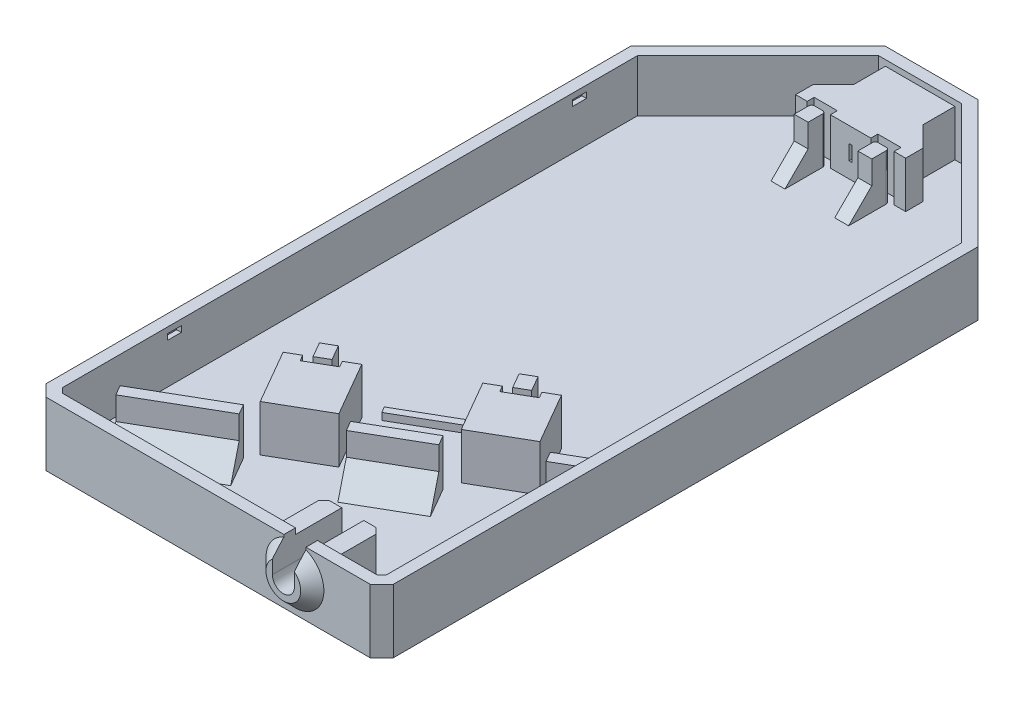
from build123d import *

# Parameters (mm, degrees)
BOSS_EXTRUDE1_DEPTH     = 11
SHELL1_T                = -2
CUT_EXTRUDE7_START      = -0.8
SKETCH18_W              = 2.4
SKETCH18_H              = 1
CUT_EXTRUDE7_DEPTH      = 57.6
SKETCH17_W              = 2.4
SKETCH17_H              = 1
CUT_EXTRUDE8_DEPTH      = 0.8
BOSS_EXTRUDE2_DEPTH     = 8
CUT_EXTRUDE1_DEPTH      = 7.5
CUT_EXTRUDE2_REACH      = 123.767
SKETCH6_R               = 1.3
BOSS_EXTRUDE6_DEPTH     = 8
SKETCH7_R               = 5
BOSS_EXTRUDE4_DEPTH     = 2
CHAMFER2_SIZE           = 2
BOSS_EXTRUDE8_DEPTH     = 8
CUT_EXTRUDE3_REACH      = 132.958
SKETCH9_R               = 1.9
SKETCH10_W              = 3.8
SKETCH10_H              = 12
CUT_EXTRUDE4_DEPTH      = 5
CUT_EXTRUDE5_DEPTH      = 6.75
CUT_EXTRUDE5_DEPTH_BACK = 0.4
SKETCH11_W              = 4.2
SKETCH11_H              = 4
SKETCH13_W              = 3.25
SKETCH13_H              = 8
BOSS_EXTRUDE5_DEPTH     = 1
CHAMFER3_SIZE           = 4
SKETCH16_R              = 0.95
BOSS_EXTRUDE7_DEPTH     = 0.5
CHAMFER4_SIZE           = 0.5
SKETCH21_W              = 0.4
SKETCH21_H              = 3.5
BOSS_EXTRUDE9_DEPTH     = 0.2
CHAMFER5_SIZE           = 0.2
BOSS_EXTRUDE10_DEPTH    = 1.2


with BuildPart() as part:
    # Sketch1 → Boss-Extrude1 (new body)
    with BuildSketch(Plane(origin=(0, 0, 0), x_dir=(1, 0, 0), z_dir=(0, 1, 0))):
        Polygon((-30, 66), (-30, -35), (-28, -37), (28, -37), (30, -35), (30, 66), (8, 88), (-8, 88), align=None)
    extrude(amount=BOSS_EXTRUDE1_DEPTH)

    # Shell1
    shell1_openings = [part.faces().sort_by_distance(p)[0] for p in [
        (0, 11, -21.727419662),
    ]]
    offset(amount=SHELL1_T, openings=shell1_openings, kind=Kind.INTERSECTION)

    # Sketch18 → Cut-Extrude7 (cut)
    with BuildSketch(Plane(origin=(-28, 0, 0), x_dir=(0, 0, -1), z_dir=(1, 0, 0)).offset(CUT_EXTRUDE7_START)):
        with Locations((-14.828427125, 9.5)):
            Rectangle(SKETCH18_W, SKETCH18_H)
        with Locations((55.171572875, 9.5)):
            Rectangle(SKETCH18_W, SKETCH18_H)
    extrude(amount=CUT_EXTRUDE7_DEPTH, mode=Mode.SUBTRACT)

    # Sketch17 → Cut-Extrude8 (cut)
    with BuildSketch(Plane.XY.offset(35)):
        with Locations((0, 9.5)):
            Rectangle(SKETCH17_W, SKETCH17_H)
    extrude(amount=CUT_EXTRUDE8_DEPTH, mode=Mode.SUBTRACT)

    # Sketch4 → Boss-Extrude2 (add)
    with BuildSketch(Plane(origin=(0, 2, 0), x_dir=(1, 0, 0), z_dir=(0, 1, 0))):
        Polygon((-6, 80.5), (-9.5, 77), (-9.5, 74), (-7.5, 74), (-7.5, 75.2), (-3.5, 75.2), (-3.5, 74), (3.5, 74), (3.5, 75.2), (7.5, 75.2), (7.5, 74), (9.5, 74), (9.5, 77), (6, 80.5), (6, 86), (-6, 86), align=None)
        with BuildLine():
            Line((-6.2, 73.95), (-4.8, 73.95))
            ThreePointArc((-4.8, 73.95), (-4.446446609, 73.803553391), (-4.3, 73.45))
            Line((-4.3, 73.45), (-4.3, 70.95))
            Line((-4.3, 70.95), (-6.7, 70.95))
            Line((-6.7, 70.95), (-6.7, 73.45))
            ThreePointArc((-6.7, 73.45), (-6.553553391, 73.803553391), (-6.2, 73.95))
        make_face()
        with BuildLine():
            Line((6.2, 73.95), (4.8, 73.95))
            ThreePointArc((4.8, 73.95), (4.446446609, 73.803553391), (4.3, 73.45))
            Line((4.3, 73.45), (4.3, 70.95))
            Line((4.3, 70.95), (6.7, 70.95))
            Line((6.7, 70.95), (6.7, 73.45))
            ThreePointArc((6.7, 73.45), (6.553553391, 73.803553391), (6.2, 73.95))
        make_face()
    extrude(amount=BOSS_EXTRUDE2_DEPTH)

    # Sketch5 → Cut-Extrude1 (cut)
    with BuildSketch(Plane(origin=(0, 0, -88), x_dir=(-1, 0, 0), z_dir=(0, 0, -1))):
        with BuildLine():
            Line((-2.175, 9.175), (2.175, 9.175))
            Line((2.175, 9.175), (3.175, 9.175))
            Line((3.175, 9.175), (3.175, 8.175))
            Line((3.175, 8.175), (3.175, 6.8))
            ThreePointArc((3.175, 6.8), (3.975, 6), (3.175, 5.2))
            Line((3.175, 5.2), (3.175, 2.825))
            Line((3.175, 2.825), (-3.175, 2.825))
            Line((-3.175, 2.825), (-3.175, 5.2))
            ThreePointArc((-3.175, 5.2), (-3.975, 6), (-3.175, 6.8))
            Line((-3.175, 6.8), (-3.175, 8.175))
            Line((-3.175, 8.175), (-3.175, 9.175))
            Line((-3.175, 9.175), (-2.175, 9.175))
        make_face()
    extrude(amount=-CUT_EXTRUDE1_DEPTH, mode=Mode.SUBTRACT)

    # Sketch6 → Cut-Extrude2 (cut, up to next)
    with BuildSketch(Plane(origin=(0, 0, -80.5), x_dir=(-1, 0, 0), z_dir=(0, 0, -1)), mode=Mode.PRIVATE) as cut_extrude2_sk1:
        with Locations((0, 6)):
            Circle(SKETCH6_R)
    cut_extrude2_tool1 = extrude(cut_extrude2_sk1.sketch, amount=-CUT_EXTRUDE2_REACH, mode=Mode.PRIVATE) & part.part
    add(cut_extrude2_tool1.solids().sort_by_distance((0, 6, -80.5))[0], mode=Mode.SUBTRACT)

    # Sketch15 → Boss-Extrude6 (add)
    with BuildSketch(Plane(origin=(0, 2, 0), x_dir=(1, 0, 0), z_dir=(0, 1, 0))):
        Polygon((-15.242047107, -8.8), (-9.842047107, -18.153074361), (-1.225094339, -13.178074361), (-6.625094339, -3.825), (-8.768507213, -5.0625), (-8.168507213, -6.101730485), (-12.498634232, -8.601730485), (-13.098634232, -7.5625), align=None)
        Polygon((-9.800892833, -21.824355653), (-10.800892833, -20.092304845), (-24.310889132, -27.892304845), (-23.310889132, -29.624355653), align=None)
        Polygon((11.066248612, -7.467304845), (0.933751388, -13.317304845), (1.933751388, -15.049355653), (12.066248612, -9.199355653), align=None)
        Polygon((28, 0), (28, 2.309401077), (22.800892833, -0.692304845), (23.800892833, -2.424355653), align=None)
        Polygon((-11.997801207, -6.86919873), (-9.919340238, -5.66919873), (-11.419340238, -3.071122518), (-13.497801207, -4.271122518), align=None)
        Polygon((8.369340238, 8.353877482), (9.869340238, 5.75580127), (11.947801207, 6.95580127), (10.447801207, 9.553877482), align=None)
        Polygon((15.242047107, 8.8), (13.098634232, 7.5625), (13.698634232, 6.523269515), (9.368507213, 4.023269515), (8.768507213, 5.0625), (6.625094339, 3.825), (11.700094339, -4.965157848), (20.317047107, 0.009842152), align=None)
    extrude(amount=BOSS_EXTRUDE6_DEPTH)

    # Sketch7 → Boss-Extrude4 (add)
    with BuildSketch(Plane.XY.offset(37)):
        with Locations(Location((15, 6, 0), (0, 0, 90))):
            Circle(SKETCH7_R)
    extrude(amount=BOSS_EXTRUDE4_DEPTH)

    # Chamfer2
    chamfer2_edges = [part.edges().sort_by_distance(p)[0] for p in [
        (15, 1, 39),
    ]]
    chamfer(chamfer2_edges, length=CHAMFER2_SIZE - 0.0001)  # a hair under: the kernel refuses the full size

    # Sketch19 → Boss-Extrude8 (add)
    with BuildSketch(Plane(origin=(0, 2, 0), x_dir=(1, 0, 0), z_dir=(0, 1, 0))):
        Polygon((10, -35), (20, -35), (20, -28), (19, -27), (11, -27), (10, -28), align=None)
    extrude(amount=BOSS_EXTRUDE8_DEPTH)

    # Sketch9 → Cut-Extrude3 (cut, up to next)
    with BuildSketch(Plane.XY.offset(39), mode=Mode.PRIVATE) as cut_extrude3_sk1:
        with Locations((15, 6)):
            Circle(SKETCH9_R)
    cut_extrude3_tool1 = extrude(cut_extrude3_sk1.sketch, amount=-CUT_EXTRUDE3_REACH, mode=Mode.PRIVATE) & part.part
    add(cut_extrude3_tool1.solids().sort_by_distance((15, 6, 39))[0], mode=Mode.SUBTRACT)

    # Sketch10 → Cut-Extrude4 (cut)
    with BuildSketch(Plane(origin=(0, 11, 0), x_dir=(1, 0, 0), z_dir=(0, 1, 0))):
        with Locations((15, -33)):
            Rectangle(SKETCH10_W, SKETCH10_H)
    extrude(amount=-CUT_EXTRUDE4_DEPTH, mode=Mode.SUBTRACT)

    # Sketch11 → Cut-Extrude5 (cut, two sides: drawn at the far end of the back side and taken through both)
    with BuildSketch(Plane.XZ.offset(-9.175).offset(-CUT_EXTRUDE5_DEPTH_BACK)):
        with Locations((0, -82.5)):
            Rectangle(SKETCH11_W, SKETCH11_H)
    extrude(amount=CUT_EXTRUDE5_DEPTH + CUT_EXTRUDE5_DEPTH_BACK, mode=Mode.SUBTRACT)

    # Sketch13 → Boss-Extrude5 (add)
    with BuildSketch(Plane.XY.offset(-74)):
        with Locations((-1.875, 6)):
            Rectangle(SKETCH13_W, SKETCH13_H)
        with Locations((1.875, 6)):
            Rectangle(SKETCH13_W, SKETCH13_H)
    extrude(amount=-BOSS_EXTRUDE5_DEPTH)

    # Chamfer3
    chamfer3_edges = [part.edges().sort_by_distance(p)[0] for p in [
        (5.5, 2, -70.95),
        (-5.5, 2, -70.95),
        (7, 2, 12.124355653),
        (-12.458570723, 2, 3.671122518),
        (-16.555890983, 2, 25.724355653),
        (9.408570723, 2, -8.953877482),
        (25.900446417, 2, 1.212177826),
    ]]
    chamfer(chamfer3_edges, length=CHAMFER3_SIZE)

    # Sketch16 → Boss-Extrude7 (add)
    with BuildSketch(Plane(origin=(6, 0, 10.392304845), x_dir=(-0.8660254037844386, 0, 0.5), z_dir=(-0.5000000000000001, 0, -0.8660254037844387))):
        with Locations((-22.5, 8)):
            Circle(SKETCH16_R)
        with Locations((-22.5, 4)):
            Circle(SKETCH16_R)
        with Locations((26, 8)):
            Circle(SKETCH16_R)
    extrude(amount=BOSS_EXTRUDE7_DEPTH)

    # Chamfer4
    chamfer4_edges = [part.edges().sort_by_distance(p)[0] for p in [
        (26.058295719, 8, -1.765707856),
        (26.058295719, 4, -1.765707856),
        (-15.943936365, 8, 22.484292144),
    ]]
    chamfer(chamfer4_edges, length=CHAMFER4_SIZE - 0.0001)  # a hair under: the kernel refuses the full size

    # Sketch21 → Boss-Extrude9 (add)
    with BuildSketch(Plane.XZ.offset(-2.825)):
        with Locations((-1.9, -86.25)):
            Rectangle(SKETCH21_W, SKETCH21_H)
        with Locations((1.9, -86.25)):
            Rectangle(SKETCH21_W, SKETCH21_H)
    extrude(amount=-BOSS_EXTRUDE9_DEPTH)

    # Chamfer5
    chamfer5_edges = [part.edges().sort_by_distance(p)[0] for p in [
        (1.9, 3.025, -88),
        (-1.9, 3.025, -88),
    ]]
    chamfer(chamfer5_edges, length=CHAMFER5_SIZE)

    # Sketch22 → Boss-Extrude10 (add)
    with BuildSketch(Plane(origin=(0, 2, 0), x_dir=(1, 0, 0), z_dir=(0, 1, 0))):
        Polygon((-4.510030829, -2.48839746), (4.410030829, 2.66160254), (3.810030829, 3.700833025), (-5.110030829, -1.449166975), align=None)
    extrude(amount=BOSS_EXTRUDE10_DEPTH)


solid = part.part
